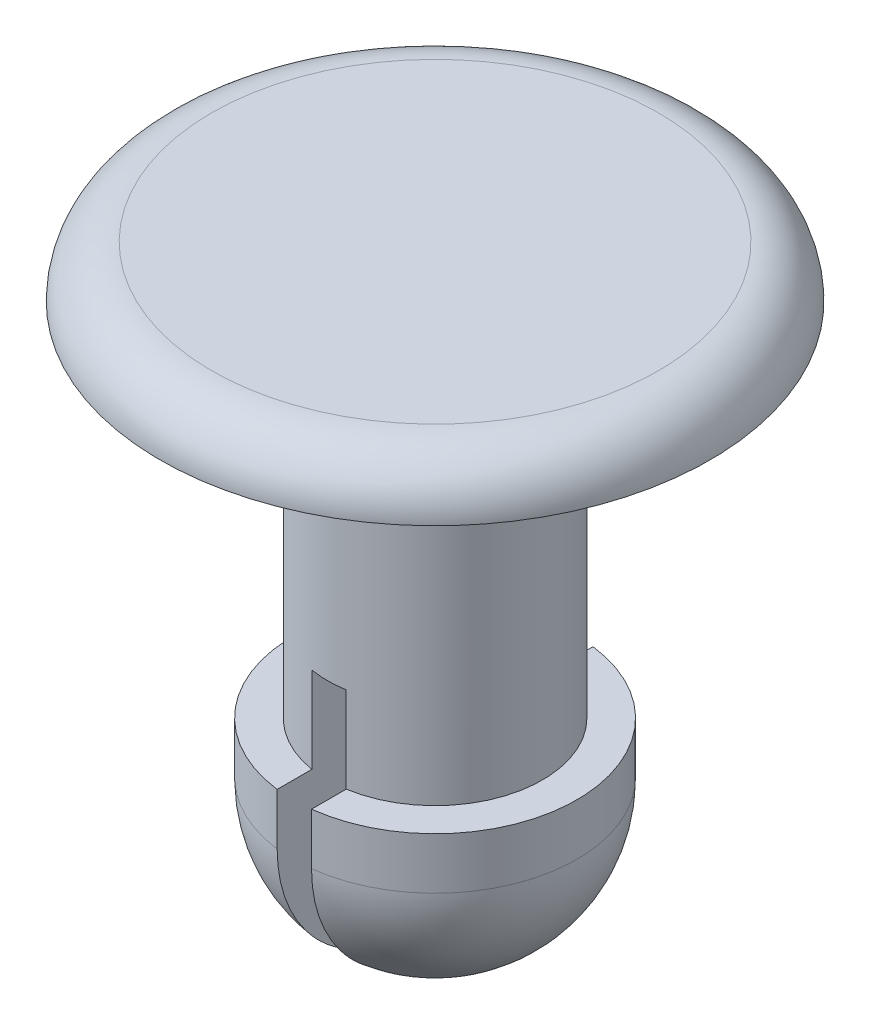
from build123d import *

# Parameters (mm, degrees)
FILLET1_R       = 0.762
SLOT_DEPTH      = 11.006641007
SLOT_DEPTH_BACK = 11.006641007
SKETCH2_W       = 0.508
SKETCH2_H       = 4.1275


with BuildPart() as part:
    # Sketch1 → Base-Revolve (revolve)
    with BuildSketch(Plane.XY, mode=Mode.PRIVATE) as base_revolve_sk:
        with BuildLine():
            Line((0, 0.762), (4.064, 0.762))
            Line((4.064, 0.762), (4.064, 0))
            Line((4.064, 0), (1.5875, 0))
            Line((1.5875, 0), (1.5875, -5.334))
            Line((1.5875, -5.334), (2.0955, -5.334))
            Line((2.0955, -5.334), (2.0955, -6.096))
            ThreePointArc((2.0955, -6.096), (1.48174226, -7.57774226), (0, -8.1915))
            Line((0, -8.1915), (0, 0.762))
        make_face()
    revolve(base_revolve_sk.sketch.rotate(Axis((0, 0, 0), (0, -1, 0)), 180), axis=Axis((0, 0, 0), (0, -1, 0)))

    # Fillet1
    fillet1_edges = [part.edges().sort_by_distance(p)[0] for p in [
        (4.064, 0.762, 0),
    ]]
    fillet(fillet1_edges, radius=FILLET1_R - 0.0001)  # a hair under: the kernel refuses the full size

    # Sketch2 → Slot (cut, two sides: drawn at the far end of the back side and taken through both)
    with BuildSketch(Plane.XY.offset(-SLOT_DEPTH_BACK)):
        with Locations((0, -6.12775)):
            Rectangle(SKETCH2_W, SKETCH2_H)
    extrude(amount=SLOT_DEPTH + SLOT_DEPTH_BACK, mode=Mode.SUBTRACT)


solid = part.part
